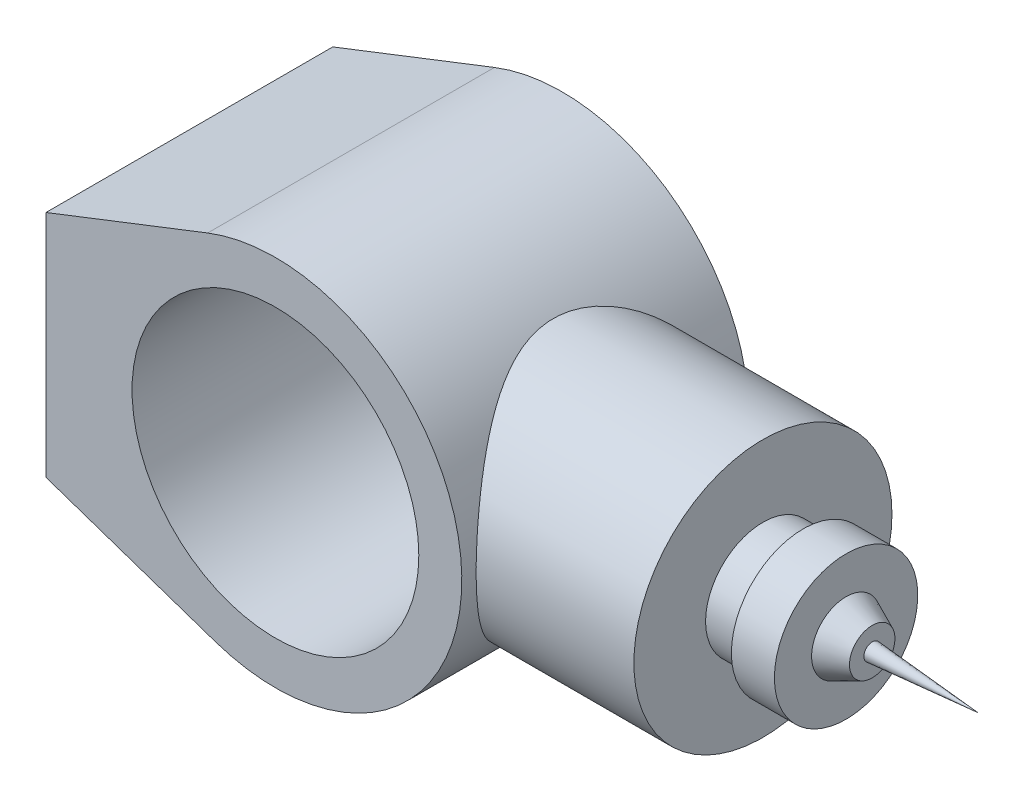
from build123d import *

# Parameters (mm, degrees)
SKETCH1_R               = 50
BOSS_EXTRUDE1_DEPTH     = 50
BOSS_EXTRUDE2_START     = -73.095841729
BOSS_EXTRUDE2_OUTLINE_R = 45
BOSS_EXTRUDE2_DEPTH     = 73.095841729
BOSS_EXTRUDE2_START_2   = -46
BOSS_EXTRUDE2_2_DEPTH   = 92


with BuildPart() as part:
    # Sketch1 → Boss-Extrude1 (new, symmetric)
    with BuildSketch(Plane.XY):
        with BuildLine():
            Line((-80, 38.563284016), (-23.622164647, 60.555704417))
            ThreePointArc((-23.622164647, 60.555704417), (64.984321325, 1.427579024), (-20.940077251, -61.534650115))
            Line((-20.940077251, -61.534650115), (-80, -41.436715984))
            Line((-80, -41.436715984), (-80, 38.563284016))
        make_face()
        Circle(SKETCH1_R, mode=Mode.SUBTRACT)
    extrude(amount=BOSS_EXTRUDE1_DEPTH, both=True)


with BuildPart() as body_2:
    # Boss-Extrude2: read off the stored shape, not the designer's step
    # Boss-Extrude2 outline → Boss-Extrude2 (new body)
    with BuildSketch(Plane(origin=(120, 0, 0), x_dir=(0, 0, -1), z_dir=(1, 0, 0)).offset(BOSS_EXTRUDE2_START)):
        Circle(BOSS_EXTRUDE2_OUTLINE_R)
    extrude(amount=BOSS_EXTRUDE2_DEPTH)

    # Boss-Extrude2 2 outline → Boss-Extrude2 2 (cut)
    with BuildSketch(Plane.XY.offset(BOSS_EXTRUDE2_START_2)):
        with BuildLine():
            ThreePointArc((46.904157921, -44.999999664), (65, 0), (46.90415792, 44.999999664))
            Line((46.90415792, 44.999999664), (46.904157921, -44.999999664))
        make_face()
    extrude(amount=BOSS_EXTRUDE2_2_DEPTH, mode=Mode.SUBTRACT)

    # Sketch3 → Revolve1 (revolve)
    with BuildSketch(Plane.XY, mode=Mode.PRIVATE) as revolve1_sk:
        Polygon((120, 0), (120, -20), (134, -20), (134, -25), (149, -25), (149, -12.035770347), (158.115753312, -7.924439472), (158.115753312, -2.924439472), (195, 0), align=None)
    revolve(revolve1_sk.sketch.rotate(Axis((-80, 0, 0), (1, 0, 0)), 270), axis=Axis((-80, 0, 0), (1, 0, 0)))


solid = Compound([part.part, body_2.part])
